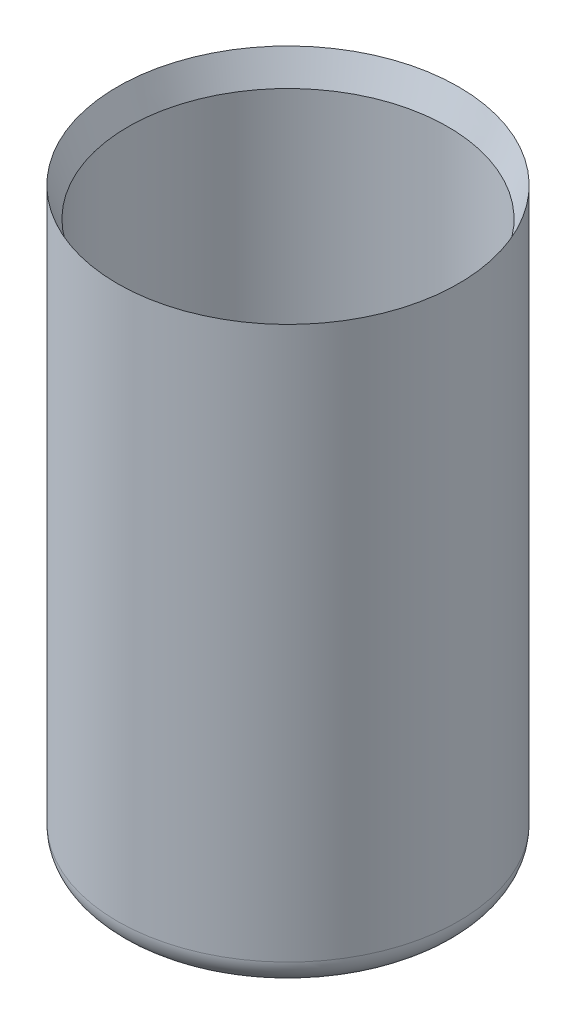
from build123d import *

# Parameters (mm, degrees)
SKETCH1_R           = 32
SKETCH1_R_2         = 30
BOSS_EXTRUDE1_DEPTH = 10
BOSS_EXTRUDE2_START = 100
SKETCH1_3_R         = 32
SKETCH1_3_R_2       = 30
BOSS_EXTRUDE2_DEPTH = 100
FILLET1_R           = 5
FILLET2_R           = 5
SKETCH2_R           = 2.5
BOSS_EXTRUDE3_DEPTH = 2
CHAMFER1_SIZE       = 2.5
CHAMFER1_SIZE_2     = 6.868693549


with BuildPart() as part:
    # Sketch1 → Boss-Extrude1 (new body)
    # profile 1 of 2: a face of its own
    with BuildSketch(Plane(origin=(0, 0, 0), x_dir=(1, 0, 0), z_dir=(0, 1, 0))):
        with Locations(Location((0, 0, 0), (0, 0, 270))):
            Circle(SKETCH1_R)
        Circle(SKETCH1_R_2, mode=Mode.SUBTRACT)
    # profile 2 of 2: a face of its own
    with BuildSketch(Plane(origin=(0, 0, 0), x_dir=(1, 0, 0), z_dir=(0, 1, 0))):
        Circle(SKETCH1_R_2)
    extrude(amount=-BOSS_EXTRUDE1_DEPTH)

    # Sketch1<3> → Boss-Extrude2 (add)
    with BuildSketch(Plane(origin=(0, 0, 0), x_dir=(1, 0, 0), z_dir=(0, 1, 0)).offset(BOSS_EXTRUDE2_START)):
        with Locations(Location((0, 0, 0), (0, 0, 270))):
            Circle(SKETCH1_3_R)
        with Locations(Location((0, 0, 0), (0, 0, 270))):
            Circle(SKETCH1_3_R_2, mode=Mode.SUBTRACT)
    extrude(amount=-BOSS_EXTRUDE2_DEPTH)

    # Fillet1
    fillet1_edges = [part.edges().sort_by_distance(p)[0] for p in [
        (0, 0, -30),
    ]]
    fillet(fillet1_edges, radius=FILLET1_R)

    # Fillet2
    fillet2_edges = [part.edges().sort_by_distance(p)[0] for p in [
        (0, -10, -32),
    ]]
    fillet(fillet2_edges, radius=FILLET2_R)

    # Sketch2 → Boss-Extrude3 (add)
    # profile 1 of 3: a face of its own
    with BuildSketch(Plane.XZ.offset(10)):
        with BuildLine():
            Line((-16.887495374, -12.25), (16.887495374, -12.25))
            ThreePointArc((16.887495374, -12.25), (19.052558883, -11), (19.052558883, -8.5))
            Line((19.052558883, -8.5), (2.165063509, 20.75))
            ThreePointArc((2.165063509, 20.75), (0, 22), (-2.165063509, 20.75))
            Line((-2.165063509, 20.75), (-19.052558883, -8.5))
            ThreePointArc((-19.052558883, -8.5), (-19.052558883, -11), (-16.887495374, -12.25))
        make_face()
        Polygon((-16.887495374, -9.75), (16.887495374, -9.75), (0, 19.5), align=None, mode=Mode.SUBTRACT)
    # profile 2 of 3: a face of its own
    with BuildSketch(Plane.XZ.offset(10)):
        with BuildLine():
            Line((-2.5, 12), (-2.5, 0))
            ThreePointArc((-2.5, 0), (0, -2.5), (2.5, 0))
            Line((2.5, 0), (2.5, 12))
            ThreePointArc((2.5, 12), (0, 14.5), (-2.5, 12))
        make_face()
    # profile 3 of 3: a face of its own
    with BuildSketch(Plane.XZ.offset(10)):
        with Locations(Location((0, -6, 0), (0, 0, 90))):
            Circle(SKETCH2_R)
    extrude(amount=BOSS_EXTRUDE3_DEPTH)

    # Chamfer1
    # the kernel refuses this chamfer: 6.868693549, 2.5 mm, written as the material it takes off along each edge
    with BuildSketch(Plane(origin=(0, 100, 0), x_dir=(0, 0, 1), z_dir=(-1, 0, 0))) as chamfer1_piece_1:
        Polygon((30 + CHAMFER1_SIZE, 0), (30, -CHAMFER1_SIZE_2), (30, 0), align=None)
    revolve(axis=Axis((0, 100, 0), (0, 1, 0)), mode=Mode.SUBTRACT)


solid = part.part
